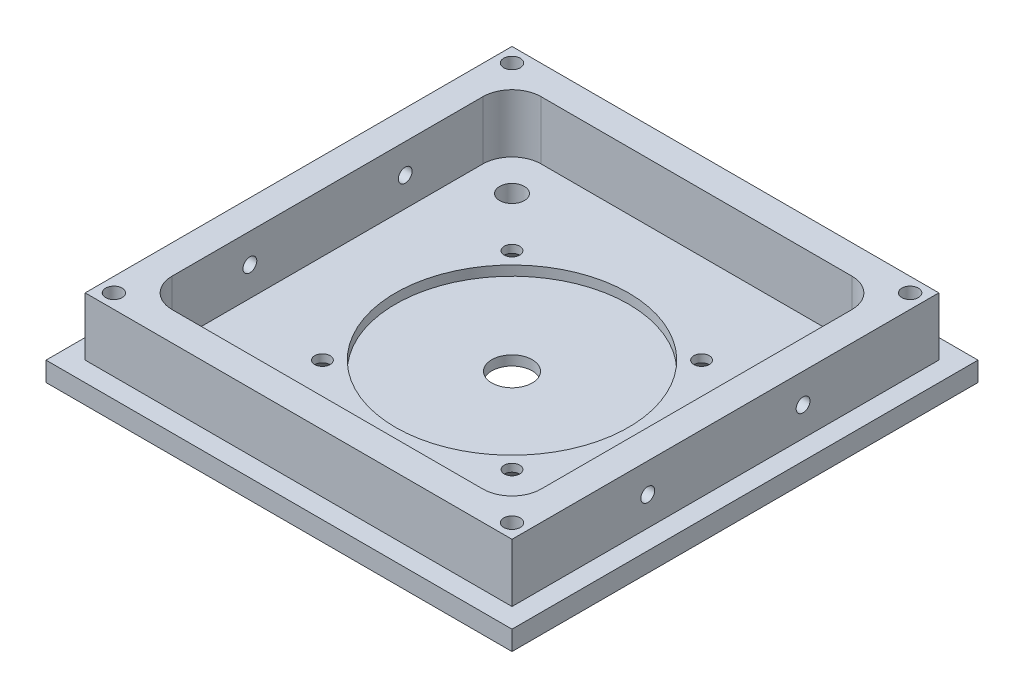
from build123d import *
from OCP.BRepFilletAPI import BRepFilletAPI_MakeChamfer

# Parameters (mm, degrees)
SKETCH1_W                    = 76.2
SKETCH1_H                    = 76.2
BOSS_EXTRUDE1_DEPTH          = 3.175
SKETCH2_W                    = 69.79412
SKETCH2_H                    = 69.79412
SKETCH2_W_2                  = 60.325
SKETCH2_H_2                  = 60.325
BOSS_EXTRUDE2_DEPTH          = 9.525
FILLET1_R                    = 4.7625
SKETCH3_R                    = 19.05
CUT_EXTRUDE1_DEPTH           = 1.5875
SKETCH4_R                    = 3.302
CUT_EXTRUDE2_DEPTH           = 56.015521957
F_39_0_0995_DIAMETER_HOLE1_D = 2.5273
F_10_32_TAPPED_HOLE1_D       = 4.0386
CHAMFER1_SIZE                = 1.905
CHAMFER1_SIZE2               = 1.655991236
F_6_32_TAPPED_HOLE1_D        = 2.7051
CIRPATTERN1_COUNT            = 4


with BuildPart() as part:
    # Sketch1 → Boss-Extrude1 (new body)
    with BuildSketch(Plane(origin=(0, 0, 0), x_dir=(1, 0, 0), z_dir=(0, 1, 0))):
        Rectangle(SKETCH1_W, SKETCH1_H)
    extrude(amount=BOSS_EXTRUDE1_DEPTH)

    # Sketch2 → Boss-Extrude2 (add)
    with BuildSketch(Plane(origin=(0, 3.175, 0), x_dir=(1, 0, 0), z_dir=(0, 1, 0))):
        Rectangle(SKETCH2_W, SKETCH2_H)
        Rectangle(SKETCH2_W_2, SKETCH2_H_2, mode=Mode.SUBTRACT)
    extrude(amount=BOSS_EXTRUDE2_DEPTH)

    # Fillet1
    fillet1_edges = [part.edges().sort_by_distance(p)[0] for p in [
        (-30.1625, 7.9375, 30.1625),
        (30.1625, 7.9375, 30.1625),
        (30.1625, 7.9375, -30.1625),
        (-30.1625, 7.9375, -30.1625),
    ]]
    fillet(fillet1_edges, radius=FILLET1_R)

    # Sketch3 → Cut-Extrude1 (cut)
    with BuildSketch(Plane(origin=(0, 3.175, 0), x_dir=(1, 0, 0), z_dir=(0, 1, 0))):
        Circle(SKETCH3_R)
    extrude(amount=-CUT_EXTRUDE1_DEPTH, mode=Mode.SUBTRACT)

    # Sketch4 → Cut-Extrude2 (cut, through all)
    with BuildSketch(Plane(origin=(0, 1.5875, 0), x_dir=(1, 0, 0), z_dir=(0, 1, 0))):
        Circle(SKETCH4_R)
    extrude(amount=-CUT_EXTRUDE2_DEPTH, mode=Mode.SUBTRACT)

    # #39 (0.0995) Diameter Hole1 (through all)
    with Locations(Plane(origin=(0, 3.175, 0), x_dir=(1, 0, 0), z_dir=(0, 1, 0))):
        with Locations((15.5, 15.5), (-15.5, 15.5), (-15.5, -15.5), (15.5, -15.5), (-23.5966, 23.5966), (23.5966, 23.5966), (23.5966, -23.5966), (-23.5966, -23.5966)):
            Hole(F_39_0_0995_DIAMETER_HOLE1_D / 2)

    # #10-32 Tapped Hole1 (through all)
    with Locations(Plane(origin=(0, 3.175, 0), x_dir=(1, 0, 0), z_dir=(0, 1, 0))):
        with Locations((-23.5966, 23.5966), (23.5966, 23.5966), (23.5966, -23.5966), (-23.5966, -23.5966)):
            Hole(F_10_32_TAPPED_HOLE1_D / 2)

    # Sketch9 → #4-40 Tapped Hole1 (revolve, cut)
    with BuildSketch(Plane(origin=(34.89706, 7.9375, 12.7), x_dir=(0, 0, -1), z_dir=(0, 1, 0))):
        Polygon((0, 0), (0, 7.283152758), (1.1303, 6.604), (1.1303, 0), align=None)
    f_4_40_tapped_hole1 = revolve(axis=Axis((41.24706, 7.9375, 12.7), (-1, 0, 0)), mode=Mode.SUBTRACT)

    # Mirror1: #4-40 Tapped Hole1 across plane
    add(f_4_40_tapped_hole1.mirror(Plane.XY), mode=Mode.SUBTRACT)

    # Mirror2 copy 1 sketch → Mirror2 copy 1 (revolve, cut)
    with BuildSketch(Plane(origin=(-34.89706, 7.9375, -12.7), x_dir=(0, 0, 1), z_dir=(0, 1, 0))):
        Polygon((0, 0), (0, 7.283152758), (1.1303, 6.604), (1.1303, 0), align=None)
    revolve(axis=Axis((-41.24706, 7.9375, -12.7), (1, 0, 0)), mode=Mode.SUBTRACT)

    # Mirror2 copy 2 sketch → Mirror2 copy 2 (revolve, cut)
    with BuildSketch(Plane(origin=(-34.89706, 7.9375, 12.7), x_dir=(0, 0, -1), z_dir=(0, 1, 0))):
        Polygon((0, 0), (0, -7.283152758), (1.1303, -6.604), (1.1303, 0), align=None)
    revolve(axis=Axis((-41.24706, 7.9375, 12.7), (-1, 0, 0)), mode=Mode.SUBTRACT)

    # Chamfer1: one chamfer whose edges measure the first distance from different faces: ONE call of the kernel's chamfer builder (chamfer() names one face for all edges)
    chamfer1_edges_1 = [part.edges().sort_by_distance(p)[0] for p in [
        (-14.23635, 0, -15.5),
    ]]
    chamfer1_side_1 = [part.faces().sort_by_distance(p)[0] for p in [
        (-14.23635, 1.5875, -15.5),
    ]]
    chamfer1_edges_2 = [part.edges().sort_by_distance(p)[0] for p in [
        (16.76365, 0, -15.5),
    ]]
    chamfer1_side_2 = [part.faces().sort_by_distance(p)[0] for p in [
        (16.76365, 1.5875, -15.5),
    ]]
    chamfer1_edges_3 = [part.edges().sort_by_distance(p)[0] for p in [
        (16.76365, 0, 15.5),
    ]]
    chamfer1_side_3 = [part.faces().sort_by_distance(p)[0] for p in [
        (16.76365, 1.5875, 15.5),
    ]]
    chamfer1_edges_4 = [part.edges().sort_by_distance(p)[0] for p in [
        (-14.23635, 0, 15.5),
    ]]
    chamfer1_side_4 = [part.faces().sort_by_distance(p)[0] for p in [
        (-14.23635, 1.5875, 15.5),
    ]]
    chamfer1 = BRepFilletAPI_MakeChamfer(part.part.solid().wrapped)
    for e in chamfer1_edges_1:
        chamfer1.Add(CHAMFER1_SIZE, CHAMFER1_SIZE2, e.wrapped, chamfer1_side_1[0].wrapped)  # the first distance lies on this face
    for e in chamfer1_edges_2:
        chamfer1.Add(CHAMFER1_SIZE, CHAMFER1_SIZE2, e.wrapped, chamfer1_side_2[0].wrapped)  # the first distance lies on this face
    for e in chamfer1_edges_3:
        chamfer1.Add(CHAMFER1_SIZE, CHAMFER1_SIZE2, e.wrapped, chamfer1_side_3[0].wrapped)  # the first distance lies on this face
    for e in chamfer1_edges_4:
        chamfer1.Add(CHAMFER1_SIZE, CHAMFER1_SIZE2, e.wrapped, chamfer1_side_4[0].wrapped)  # the first distance lies on this face
    add(Compound.cast(chamfer1.Shape()), mode=Mode.REPLACE)

    # #6-32 Tapped Hole1 (through all)
    with Locations(Plane(origin=(0, 0, 0), x_dir=(-1, 0, 0), z_dir=(0, -1, 0))):
        with Locations((-32.5501, 32.5501)):
            f_6_32_tapped_hole1 = Hole(F_6_32_TAPPED_HOLE1_D / 2)

    # CirPattern1: #6-32 Tapped Hole1 ×4 about axis
    cirpattern1_axis = Axis((0, 0, 0), (0, 1, 0))
    for i in range(1, CIRPATTERN1_COUNT):
        add(f_6_32_tapped_hole1.rotate(cirpattern1_axis, i * 360 / CIRPATTERN1_COUNT), mode=Mode.SUBTRACT)


solid = part.part
